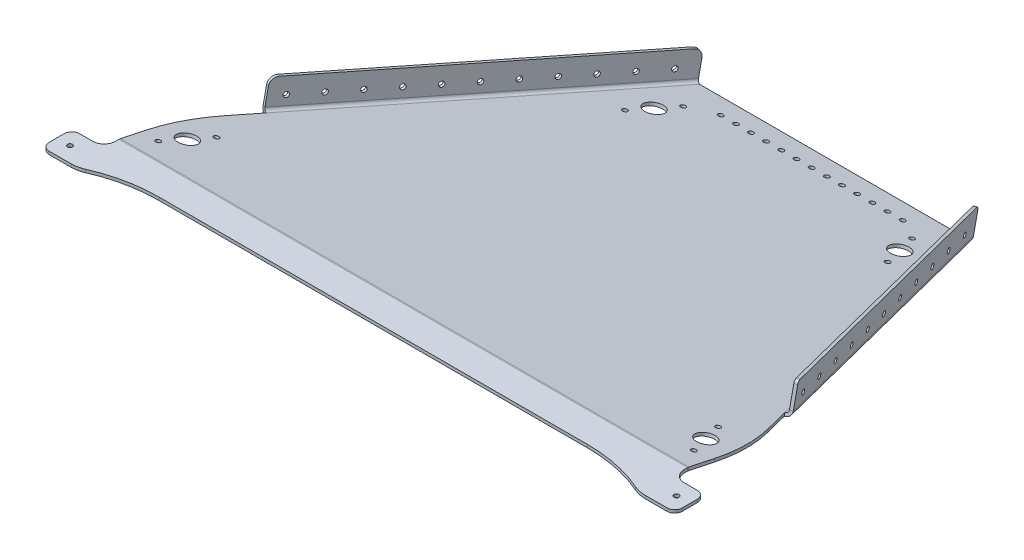
from build123d import *

# Parameters (mm, degrees)
BOSS_EXTRUDE1_DEPTH                   = 254
CONVERT_SOLID1_START                  = -254
CONVERT_SOLID1_DEPTH                  = 508
CONVERT_SOLID1_2_DEPTH                = 508
CUT_EXTRUDE1_DEPTH                    = 574.396643949
EDGE_FLANGE1_DEPTH                    = 283.392941468
SKETCH12_R                            = 7.9375
CUT_EXTRUDE2_DEPTH                    = 574.492170143
F_1_4_0_25_DIAMETER_HOLE2_AT_2_COUNT  = 2
F_1_4_0_25_DIAMETER_HOLE2_AT_2_PITCH  = 25.4
F_1_4_0_25_DIAMETER_HOLE2_AT_3_COUNT  = 2
F_1_4_0_25_DIAMETER_HOLE2_AT_3_PITCH  = 50.8
F_1_4_0_25_DIAMETER_HOLE2_AT_4_COUNT  = 2
F_1_4_0_25_DIAMETER_HOLE2_AT_4_PITCH  = 76.2
F_1_4_0_25_DIAMETER_HOLE2_AT_5_COUNT  = 2
F_1_4_0_25_DIAMETER_HOLE2_AT_5_PITCH  = 101.6
F_1_4_0_25_DIAMETER_HOLE2_AT_6_COUNT  = 2
F_1_4_0_25_DIAMETER_HOLE2_AT_6_PITCH  = 127
F_1_4_0_25_DIAMETER_HOLE2_AT_7_COUNT  = 2
F_1_4_0_25_DIAMETER_HOLE2_AT_7_PITCH  = 152.4
F_1_4_0_25_DIAMETER_HOLE2_AT_8_COUNT  = 2
F_1_4_0_25_DIAMETER_HOLE2_AT_8_PITCH  = 177.8
F_1_4_0_25_DIAMETER_HOLE2_AT_9_COUNT  = 2
F_1_4_0_25_DIAMETER_HOLE2_AT_9_PITCH  = 203.2
F_1_4_0_25_DIAMETER_HOLE2_AT_10_COUNT = 2
F_1_4_0_25_DIAMETER_HOLE2_AT_10_PITCH = 228.6
F_1_4_0_25_DIAMETER_HOLE2_AT_11_COUNT = 2
F_1_4_0_25_DIAMETER_HOLE2_AT_11_PITCH = 254
F_1_4_0_25_DIAMETER_HOLE2_AT_12_COUNT = 2
F_1_4_0_25_DIAMETER_HOLE2_AT_12_PITCH = 279.4
F_1_4_0_25_DIAMETER_HOLE2_AT_13_COUNT = 2
F_1_4_0_25_DIAMETER_HOLE2_AT_13_PITCH = 304.8
F_1_4_0_25_DIAMETER_HOLE2_AT_14_COUNT = 2
F_1_4_0_25_DIAMETER_HOLE2_AT_14_PITCH = 330.2
F_1_4_0_25_DIAMETER_HOLE2_AT_15_COUNT = 2
F_1_4_0_25_DIAMETER_HOLE2_AT_15_PITCH = 355.6
F_1_4_0_25_DIAMETER_HOLE2_AT_16_COUNT = 2
F_1_4_0_25_DIAMETER_HOLE2_AT_16_PITCH = 381
F_1_4_0_25_DIAMETER_HOLE5_D           = 4.191
F_1_4_0_25_DIAMETER_HOLE5_DEPTH       = 254
F_1_4_0_25_DIAMETER_HOLE5_TIP         = 1.259103427
SKETCH25_R                            = 2.0955
CUT_EXTRUDE3_DEPTH                    = 2.54
FILLET1_R                             = 2.54
CUT_EXTRUDE5_DEPTH                    = 12.7
SKETCH31_R                            = 2.0701
BOSS_EXTRUDE2_DEPTH                   = 2.54
MIRROR12_START                        = -62.348647606
MIRROR12_OUTLINE_R                    = 2.0955
MIRROR12_DEPTH                        = 2.54
FILLET2_R                             = 152.4
FILLET3_R                             = 6.35
FILLET4_R                             = 9.54532
FILLET5_R                             = 127
FILLET6_R                             = 25.4


# Read off the part's stored shape, not the designer's step: Convert-Solid1, Mirror12
# Sheet-metal steps are written as plain solids
with BuildPart() as part:
    # Sketch3 → Boss-Extrude1 (new, symmetric)
    with BuildSketch(Plane(origin=(0, 0, 0), x_dir=(0, 0, -1), z_dir=(1, 0, 0))):
        Polygon((-477.990419123, 101.6), (-503.390419123, 101.6), (-503.390419123, 104.14), (-477.723454365, 104.14), (-118.969509086, 27.884494906), (-119.497604781, 25.4), align=None)
    extrude(amount=BOSS_EXTRUDE1_DEPTH, both=True)

    # Convert-Solid1 outline → Convert-Solid1 (cut)
    with BuildSketch(Plane.YZ.offset(CONVERT_SOLID1_START)):
        with BuildLine():
            Line((104.14, 477.723454365), (104.14, 478.257383881))
            ThreePointArc((104.14, 478.257383881), (104.112171228, 477.726379287), (104.028989812, 477.201192491))
            Line((104.028989812, 477.201192491), (104.14, 477.723454365))
        make_face()
    extrude(amount=CONVERT_SOLID1_DEPTH, mode=Mode.SUBTRACT)

    # Convert-Solid1 2 outline → Convert-Solid1 2 (add)
    with BuildSketch(Plane.YZ.offset(CONVERT_SOLID1_START)):
        with BuildLine():
            Line((101.6, 477.990419123), (101.6, 478.257383881))
            ThreePointArc((101.6, 478.257383881), (101.586085614, 477.991881584), (101.544494906, 477.729288186))
            Line((101.544494906, 477.729288186), (101.6, 477.990419123))
        make_face()
    extrude(amount=CONVERT_SOLID1_2_DEPTH)

    # Sketch8 → Cut-Extrude1 (cut, through all)
    with BuildSketch(Plane(origin=(0, 2.484494906, -0.528095695), x_dir=(1, 0, 0), z_dir=(0, 0.978147600733807, -0.20791169081775257))):
        Polygon((254, -475.795286538), (111.125, -122.167252357), (254, -122.167252357), align=None)
        Polygon((-254, -475.795286538), (-254, -122.167252357), (-111.125, -122.167252357), align=None)
    extrude(amount=-CUT_EXTRUDE1_DEPTH, mode=Mode.SUBTRACT)

    # Edge-Flange1 section (across the edge) → Edge-Flange1 (add)
    with BuildSketch(Plane(origin=(219.640911392, 82.316993733, 375.054282003), x_dir=(-0.9271838545667858, 0.0778850902285849, 0.36642054056884255), z_dir=(-0.3746065934159163, -0.19277236290190172, -0.9069226627836247))):
        with BuildLine():
            Line((-2.54, 2.54), (-2.54, 22.86))
            Line((-2.54, 22.86), (0, 22.86))
            Line((0, 22.86), (0, 2.54))
            ThreePointArc((0, 2.54), (0.743948776, 0.743948776), (2.54, 0))
            Line((2.54, 0), (2.54, -2.54))
            ThreePointArc((2.54, -2.54), (-1.052102448, -1.052102448), (-2.54, 2.54))
        make_face()
    edge_flange1 = extrude(amount=EDGE_FLANGE1_DEPTH)

    # Sketch12 → Cut-Extrude2 (cut, symmetric)
    with BuildSketch(Plane(origin=(0, 2.484494906, -0.528095695), x_dir=(1, 0, 0), z_dir=(0, 0.9781476007338071, -0.2079116908177526))):
        with Locations(Location((217.139677307, -452.367252357, 0), (0, 0, 90))):
            Circle(SKETCH12_R)
        with Locations(Location((102.885908047, -169.579250108, 0), (0, 0, 90))):
            Circle(SKETCH12_R)
    cut_extrude2 = extrude(amount=CUT_EXTRUDE2_DEPTH, both=True, mode=Mode.SUBTRACT)

    # Sketch18 → 1/4 (0.25) Diameter Hole2 (revolve, cut)
    with BuildSketch(Plane(origin=(217.238454646, 89.608936219, 360.493273234), x_dir=(-0.19323358469460172, 0.7385318906509463, -0.6459345386628688), z_dir=(0.3209219244251657, 0.6697048299151083, 0.6697048299151084))):
        Polygon((0, 0), (0, 412.609115775), (2.0955, 411.350012348), (2.0955, 0), align=None)
    f_1_4_0_25_diameter_hole2 = revolve(axis=Axis((223.126072123, 89.114365896, 358.166502801), (-0.9271838545667858, 0.07788509022858456, 0.3664205405688424)), mode=Mode.SUBTRACT)

    # 1/4 (0.25) Diameter Hole2 at 2: 1/4 (0.25) Diameter Hole2 ×2
    with Locations(*[Vector(-0.3746065934159161, -0.19277236290190253, -0.9069226627836244) * (i * F_1_4_0_25_DIAMETER_HOLE2_AT_2_PITCH) for i in range(1, F_1_4_0_25_DIAMETER_HOLE2_AT_2_COUNT)]):
        add(f_1_4_0_25_diameter_hole2, mode=Mode.SUBTRACT)

    # 1/4 (0.25) Diameter Hole2 at 3: 1/4 (0.25) Diameter Hole2 ×2
    with Locations(*[Vector(-0.3746065934159161, -0.19277236290190194, -0.9069226627836245) * (i * F_1_4_0_25_DIAMETER_HOLE2_AT_3_PITCH) for i in range(1, F_1_4_0_25_DIAMETER_HOLE2_AT_3_COUNT)]):
        add(f_1_4_0_25_diameter_hole2, mode=Mode.SUBTRACT)

    # 1/4 (0.25) Diameter Hole2 at 4: 1/4 (0.25) Diameter Hole2 ×2
    with Locations(*[Vector(-0.37460659341591607, -0.19277236290190208, -0.9069226627836245) * (i * F_1_4_0_25_DIAMETER_HOLE2_AT_4_PITCH) for i in range(1, F_1_4_0_25_DIAMETER_HOLE2_AT_4_COUNT)]):
        add(f_1_4_0_25_diameter_hole2, mode=Mode.SUBTRACT)

    # 1/4 (0.25) Diameter Hole2 at 5: 1/4 (0.25) Diameter Hole2 ×2
    with Locations(*[Vector(-0.37460659341591607, -0.1927723629019019, -0.9069226627836247) * (i * F_1_4_0_25_DIAMETER_HOLE2_AT_5_PITCH) for i in range(1, F_1_4_0_25_DIAMETER_HOLE2_AT_5_COUNT)]):
        add(f_1_4_0_25_diameter_hole2, mode=Mode.SUBTRACT)

    # 1/4 (0.25) Diameter Hole2 at 6: 1/4 (0.25) Diameter Hole2 ×2
    with Locations(*[Vector(-0.374606593415916, -0.19277236290190194, -0.9069226627836247) * (i * F_1_4_0_25_DIAMETER_HOLE2_AT_6_PITCH) for i in range(1, F_1_4_0_25_DIAMETER_HOLE2_AT_6_COUNT)]):
        add(f_1_4_0_25_diameter_hole2, mode=Mode.SUBTRACT)

    # 1/4 (0.25) Diameter Hole2 at 7: 1/4 (0.25) Diameter Hole2 ×2
    with Locations(*[Vector(-0.37460659341591607, -0.1927723629019018, -0.9069226627836247) * (i * F_1_4_0_25_DIAMETER_HOLE2_AT_7_PITCH) for i in range(1, F_1_4_0_25_DIAMETER_HOLE2_AT_7_COUNT)]):
        add(f_1_4_0_25_diameter_hole2, mode=Mode.SUBTRACT)

    # 1/4 (0.25) Diameter Hole2 at 8: 1/4 (0.25) Diameter Hole2 ×2
    with Locations(*[Vector(-0.37460659341591596, -0.1927723629019019, -0.9069226627836247) * (i * F_1_4_0_25_DIAMETER_HOLE2_AT_8_PITCH) for i in range(1, F_1_4_0_25_DIAMETER_HOLE2_AT_8_COUNT)]):
        add(f_1_4_0_25_diameter_hole2, mode=Mode.SUBTRACT)

    # 1/4 (0.25) Diameter Hole2 at 9: 1/4 (0.25) Diameter Hole2 ×2
    with Locations(*[Vector(-0.37460659341591607, -0.1927723629019018, -0.9069226627836245) * (i * F_1_4_0_25_DIAMETER_HOLE2_AT_9_PITCH) for i in range(1, F_1_4_0_25_DIAMETER_HOLE2_AT_9_COUNT)]):
        add(f_1_4_0_25_diameter_hole2, mode=Mode.SUBTRACT)

    # 1/4 (0.25) Diameter Hole2 at 10: 1/4 (0.25) Diameter Hole2 ×2
    with Locations(*[Vector(-0.37460659341591607, -0.19277236290190183, -0.9069226627836245) * (i * F_1_4_0_25_DIAMETER_HOLE2_AT_10_PITCH) for i in range(1, F_1_4_0_25_DIAMETER_HOLE2_AT_10_COUNT)]):
        add(f_1_4_0_25_diameter_hole2, mode=Mode.SUBTRACT)

    # 1/4 (0.25) Diameter Hole2 at 11: 1/4 (0.25) Diameter Hole2 ×2
    with Locations(*[Vector(-0.374606593415916, -0.1927723629019018, -0.9069226627836247) * (i * F_1_4_0_25_DIAMETER_HOLE2_AT_11_PITCH) for i in range(1, F_1_4_0_25_DIAMETER_HOLE2_AT_11_COUNT)]):
        add(f_1_4_0_25_diameter_hole2, mode=Mode.SUBTRACT)

    # 1/4 (0.25) Diameter Hole2 at 12: 1/4 (0.25) Diameter Hole2 ×2
    with Locations(*[Vector(-0.3746065934159161, -0.19277236290190183, -0.9069226627836245) * (i * F_1_4_0_25_DIAMETER_HOLE2_AT_12_PITCH) for i in range(1, F_1_4_0_25_DIAMETER_HOLE2_AT_12_COUNT)]):
        add(f_1_4_0_25_diameter_hole2, mode=Mode.SUBTRACT)

    # 1/4 (0.25) Diameter Hole2 at 13: 1/4 (0.25) Diameter Hole2 ×2
    with Locations(*[Vector(-0.374606593415916, -0.19277236290190183, -0.9069226627836245) * (i * F_1_4_0_25_DIAMETER_HOLE2_AT_13_PITCH) for i in range(1, F_1_4_0_25_DIAMETER_HOLE2_AT_13_COUNT)]):
        add(f_1_4_0_25_diameter_hole2, mode=Mode.SUBTRACT)

    # 1/4 (0.25) Diameter Hole2 at 14: 1/4 (0.25) Diameter Hole2 ×2
    with Locations(*[Vector(-0.374606593415916, -0.1927723629019018, -0.9069226627836245) * (i * F_1_4_0_25_DIAMETER_HOLE2_AT_14_PITCH) for i in range(1, F_1_4_0_25_DIAMETER_HOLE2_AT_14_COUNT)]):
        add(f_1_4_0_25_diameter_hole2, mode=Mode.SUBTRACT)

    # 1/4 (0.25) Diameter Hole2 at 15: 1/4 (0.25) Diameter Hole2 ×2
    with Locations(*[Vector(-0.374606593415916, -0.1927723629019018, -0.9069226627836247) * (i * F_1_4_0_25_DIAMETER_HOLE2_AT_15_PITCH) for i in range(1, F_1_4_0_25_DIAMETER_HOLE2_AT_15_COUNT)]):
        add(f_1_4_0_25_diameter_hole2, mode=Mode.SUBTRACT)

    # 1/4 (0.25) Diameter Hole2 at 16: 1/4 (0.25) Diameter Hole2 ×2
    with Locations(*[Vector(-0.37460659341591607, -0.19277236290190178, -0.9069226627836245) * (i * F_1_4_0_25_DIAMETER_HOLE2_AT_16_PITCH) for i in range(1, F_1_4_0_25_DIAMETER_HOLE2_AT_16_COUNT)]):
        add(f_1_4_0_25_diameter_hole2, mode=Mode.SUBTRACT)

    # 1/4 (0.25) Diameter Hole5
    with Locations(Plane(origin=(0, 2.484494906, -0.528095695), x_dir=(1, 0, 0), z_dir=(0, 0.9781476007338071, -0.2079116908177526))):
        with Locations((76.2, -139.814560704), (63.5, -139.814560704), (50.8, -139.814560704), (38.1, -139.814560704), (25.4, -139.814560704), (12.7, -139.814560704), (0, -139.814560704), (-12.7, -139.814560704), (-25.4, -139.814560704), (-38.1, -139.814560704), (-50.8, -139.814560704), (-63.5, -139.814560704), (-76.2, -139.814560704)):
            Hole(F_1_4_0_25_DIAMETER_HOLE5_D / 2, depth=F_1_4_0_25_DIAMETER_HOLE5_DEPTH)
            with Locations((0, 0, -(F_1_4_0_25_DIAMETER_HOLE5_DEPTH + F_1_4_0_25_DIAMETER_HOLE5_TIP / 2))):  # 118° drill point
                Cone(0, F_1_4_0_25_DIAMETER_HOLE5_D / 2, F_1_4_0_25_DIAMETER_HOLE5_TIP, mode=Mode.SUBTRACT)

    # Sketch25 → Cut-Extrude3 (cut)
    with BuildSketch(Plane(origin=(0, 2.484494906, -0.528095695), x_dir=(1, 0, 0), z_dir=(0, 0.9781476007338071, -0.2079116908177526))):
        with Locations(Location((224.275932911, -470.030104786, 0), (0, 0, 270))):
            Circle(SKETCH25_R)
        with Locations(Location((210.003421702, -434.704399927, 0), (0, 0, 270))):
            Circle(SKETCH25_R)
        with Locations(Location((110.022163651, -187.242102538, 0), (0, 0, 270))):
            Circle(SKETCH25_R)
        with Locations(Location((95.749652442, -151.916397679, 0), (0, 0, 270))):
            Circle(SKETCH25_R)
    cut_extrude3 = extrude(amount=-CUT_EXTRUDE3_DEPTH, mode=Mode.SUBTRACT)

    # Fillet1
    fillet1_edges = [part.edges().sort_by_distance(p)[0] for p in [
        (254, 102.87, 503.390419123),
        (-254, 102.87, 503.390419123),
        (220.818434887, 104.578533821, 369.836066664),
        (114.657570486, 49.948206865, 112.820585574),
    ]]
    fillet(fillet1_edges, radius=FILLET1_R)

    # Sketch26 → Cut-Extrude5 (cut)
    with BuildSketch(Plane(origin=(0, 2.484494906, -0.528095695), x_dir=(1, 0, 0), z_dir=(0, 0.978147600733807, -0.20791169081775257))):
        Polygon((-238.125, -407.275245024), (-238.125, -514.042054179), (-254, -514.042054179), (-254, -447.967999726), align=None)
    cut_extrude5 = extrude(amount=-CUT_EXTRUDE5_DEPTH, mode=Mode.SUBTRACT)

    # Sketch31 → Boss-Extrude2 (add)
    with BuildSketch(Plane(origin=(0, 104.14, 0), x_dir=(1, 0, 0), z_dir=(0, 1, 0))):
        Polygon((-219.075, -490.690419123), (-265.1125, -490.690419123), (-265.1125, -516.090419123), (-234.95, -516.090419123), (-219.075, -500.215419123), align=None)
        with Locations(Location((-254, -503.390419123, 0), (0, 0, 270))):
            Circle(SKETCH31_R, mode=Mode.SUBTRACT)
    boss_extrude2 = extrude(amount=-BOSS_EXTRUDE2_DEPTH)

    # Mirror11: Edge-Flange1, Cut-Extrude2, Cut-Extrude3, Cut-Extrude5, Boss-Extrude2 across plane
    add(edge_flange1.mirror(Plane(origin=(0, 0, 0), x_dir=(0, 0, 1), z_dir=(1, 0, 0))))
    add(cut_extrude2.mirror(Plane(origin=(0, 0, 0), x_dir=(0, 0, 1), z_dir=(1, 0, 0))), mode=Mode.SUBTRACT)
    add(cut_extrude3.mirror(Plane(origin=(0, 0, 0), x_dir=(0, 0, 1), z_dir=(1, 0, 0))), mode=Mode.SUBTRACT)
    add(cut_extrude5.mirror(Plane(origin=(0, 0, 0), x_dir=(0, 0, 1), z_dir=(1, 0, 0))), mode=Mode.SUBTRACT)
    add(boss_extrude2.mirror(Plane(origin=(0, 0, 0), x_dir=(0, 0, 1), z_dir=(1, 0, 0))))

    # Mirror12 outline → Mirror12 (cut)
    with BuildSketch(Plane(origin=(0, 0, 0), x_dir=(-0.07243382731725607, 0.9969623426790428, -0.028625651784521453), z_dir=(0.9271838545667856, 0.07788509022858449, 0.3664205405688429)).offset(MIRROR12_START)):
        with Locations((94.752792778, 415.105121718)):
            Circle(MIRROR12_OUTLINE_R)
        with Locations((89.841455801, 390.184472266)):
            Circle(MIRROR12_OUTLINE_R)
        with Locations((84.930118825, 365.263822814)):
            Circle(MIRROR12_OUTLINE_R)
        with Locations((80.018781848, 340.343173363)):
            Circle(MIRROR12_OUTLINE_R)
        with Locations((75.107444872, 315.422523911)):
            Circle(MIRROR12_OUTLINE_R)
        with Locations((70.196107896, 290.501874459)):
            Circle(MIRROR12_OUTLINE_R)
        with Locations((65.284770919, 265.581225007)):
            Circle(MIRROR12_OUTLINE_R)
        with Locations((60.373433943, 240.660575555)):
            Circle(MIRROR12_OUTLINE_R)
        with Locations((55.462096966, 215.739926103)):
            Circle(MIRROR12_OUTLINE_R)
        with Locations((50.55075999, 190.819276651)):
            Circle(MIRROR12_OUTLINE_R)
        with Locations((45.639423013, 165.898627199)):
            Circle(MIRROR12_OUTLINE_R)
    extrude(amount=MIRROR12_DEPTH, mode=Mode.SUBTRACT)

    # Fillet2
    fillet2_edges = [part.edges().sort_by_distance(p)[0] for p in [
        (-238.125, 91.996383015, 426.700590878),
        (238.125, 91.996383015, 426.700590878),
    ]]
    fillet(fillet2_edges, radius=FILLET2_R)

    # Fillet3
    fillet3_edges = [part.edges().sort_by_distance(p)[0] for p in [
        (-265.1125, 102.87, 516.090419123),
        (-265.1125, 102.87, 490.690419123),
        (-114.657570486, 49.948206865, 112.820585574),
        (-220.818434887, 104.578533821, 369.836066664),
        (265.1125, 102.87, 490.690419123),
        (265.1125, 102.87, 516.090419123),
    ]]
    fillet(fillet3_edges, radius=FILLET3_R)

    # Fillet4
    fillet4_edges = [part.edges().sort_by_distance(p)[0] for p in [
        (-238.125, 102.87, 490.690419123),
        (238.125, 102.87, 490.690419123),
    ]]
    fillet(fillet4_edges, radius=FILLET4_R)

    # Fillet5
    # the kernel refuses this fillet: 127 mm, written as the material it adds along each edge
    with BuildSketch(Plane(origin=(222.25, 104.14, 503.390419123), x_dir=(-1, 0, 0), z_dir=(0, -1, 0))) as fillet5_piece_1:
        with BuildLine():
            CenterArc((42.658016583, -127), FILLET5_R, 90, 25.841932763)
            Line((-12.7, -12.7), (-13.807160332, -10.414))
            ThreePointArc((-13.807160332, -10.414), (-8.146051224, -4.553948776), (-1.796051224, 1.796051224))
            Line((-1.796051224, 1.796051224), (0, 2.54))
            Line((0, 2.54), (42.658016583, 2.54))
            Line((42.658016583, 2.54), (42.658016583, 0))
        make_face()
    extrude(amount=2.54)
    with BuildSketch(Plane(origin=(-222.25, 104.14, 503.390419123), x_dir=(-0.7071067811865452, 0, 0.7071067811865499), z_dir=(0, -1, 0))) as fillet5_piece_2:
        with BuildLine():
            CenterArc((59.638788413, -119.966334008), FILLET5_R, 109.158067237, 25.841932763)
            Line((-30.163772798, -30.163772798), (-31.959824022, -28.367721574))
            Line((-31.959824022, -28.367721574), (-1.796051224, 1.796051224))
            Line((-1.796051224, 1.796051224), (0, 2.54))
            ThreePointArc((0, 2.54), (8.980256121, 2.54), (17.126946719, 2.39932668))
            Line((17.126946719, 2.39932668), (17.960512242, 0))
        make_face()
    extrude(amount=2.54)

    # Fillet6
    fillet6_edges = [part.edges().sort_by_distance(p)[0] for p in [
        (-234.95, 102.87, 516.090419123),
        (234.95, 102.87, 516.090419123),
    ]]
    fillet(fillet6_edges, radius=FILLET6_R)


solid = part.part
